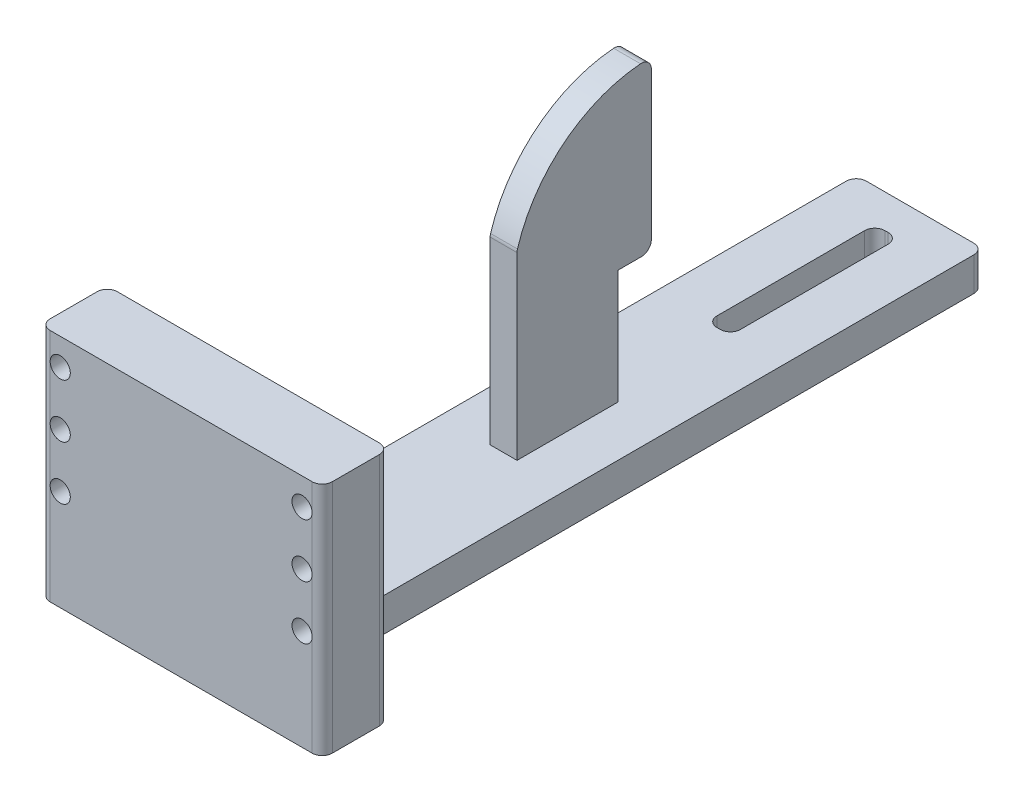
from build123d import *

# Parameters (mm, degrees)
SKETCH1_W                = 19
SKETCH1_H                = 110
SKETCH1_W_2              = 3.5
SKETCH1_H_2              = 25
BOSS_EXTRUDE1_DEPTH      = 5
BOSS_EXTRUDE2_DEPTH      = 11.5
BOSS_EXTRUDE2_DEPTH_BACK = 30.5
SKETCH3_R                = 1.5
CUT_EXTRUDE1_DEPTH       = 10
SKETCH4_W                = 4
SKETCH4_H                = 15
BOSS_EXTRUDE3_DEPTH      = 17
BOSS_EXTRUDE4_DEPTH      = 4
FILLET1_R                = 1.5


with BuildPart() as part:
    # Sketch1 → Boss-Extrude1 (new body)
    with BuildSketch(Plane(origin=(0, 0, 0), x_dir=(1, 0, 0), z_dir=(0, 1, 0))):
        with Locations((-9.5, 55)):
            Rectangle(SKETCH1_W, SKETCH1_H)
        with Locations((-9.5, 92.5)):
            Rectangle(SKETCH1_W_2, SKETCH1_H_2, mode=Mode.SUBTRACT)
    extrude(amount=BOSS_EXTRUDE1_DEPTH)

    # Sketch2 → Boss-Extrude2 (add, two sides: drawn at the far end of the back side and taken through both)
    with BuildSketch(Plane(origin=(0, 0, 0), x_dir=(0, 0, -1), z_dir=(1, 0, 0)).offset(-BOSS_EXTRUDE2_DEPTH_BACK)):
        Polygon((10, 15), (10, 35), (0, 35), (0, 15), (0, 5), (0, 0), (10, 0), (10, 5), align=None)
    extrude(amount=BOSS_EXTRUDE2_DEPTH + BOSS_EXTRUDE2_DEPTH_BACK)

    # Sketch3 → Cut-Extrude1 (cut)
    with BuildSketch(Plane(origin=(0, 0, -10), x_dir=(-1, 0, 0), z_dir=(0, 0, -1))):
        with Locations((-8.5, 31)):
            Circle(SKETCH3_R)
        with Locations((-8.5, 23)):
            Circle(SKETCH3_R)
        with Locations((-8.5, 15)):
            Circle(SKETCH3_R)
        with Locations(Location((27.5, 15, 0), (0, 0, 180))):
            Circle(SKETCH3_R)
        with Locations(Location((27.5, 23, 0), (0, 0, 180))):
            Circle(SKETCH3_R)
        with Locations(Location((27.5, 31, 0), (0, 0, 180))):
            Circle(SKETCH3_R)
    extrude(amount=-CUT_EXTRUDE1_DEPTH, mode=Mode.SUBTRACT)

    # Sketch4 → Boss-Extrude3 (add)
    with BuildSketch(Plane(origin=(0, 5, 0), x_dir=(1, 0, 0), z_dir=(0, 1, 0))):
        with Locations((-9.5, 55.5)):
            Rectangle(SKETCH4_W, SKETCH4_H)
    extrude(amount=BOSS_EXTRUDE3_DEPTH)

    # Sketch5 → Boss-Extrude4 (add)
    with BuildSketch(Plane(origin=(-7.5, 0, 0), x_dir=(0, 0, -1), z_dir=(1, 0, 0))):
        with BuildLine():
            Line((63, 22), (68, 22))
            Line((68, 22), (68, 47))
            ThreePointArc((68, 47), (55.5, 42.833333333), (48, 32))
            Line((48, 32), (48, 22))
            Line((48, 22), (63, 22))
        make_face()
    extrude(amount=-BOSS_EXTRUDE4_DEPTH)

    # Fillet1
    fillet1_edges = [part.edges().sort_by_distance(p)[0] for p in [
        (-11.25, 2.5, -105),
        (-11.25, 2.5, -80),
        (-7.75, 2.5, -80),
        (-7.75, 2.5, -105),
        (-19, 2.5, -10),
        (0, 2.5, -10),
        (-30.5, 17.5, -10),
        (-30.5, 17.5, 0),
        (-9.5, 5, -10),
        (11.5, 17.5, 0),
        (11.5, 17.5, -10),
        (-19, 2.5, -110),
        (0, 2.5, -110),
        (-9.5, 32, -48),
        (-9.5, 47, -68),
        (-9.5, 22, -68),
    ]]
    fillet(fillet1_edges, radius=FILLET1_R - 0.0001)  # a hair under: the kernel refuses the full size


solid = part.part
